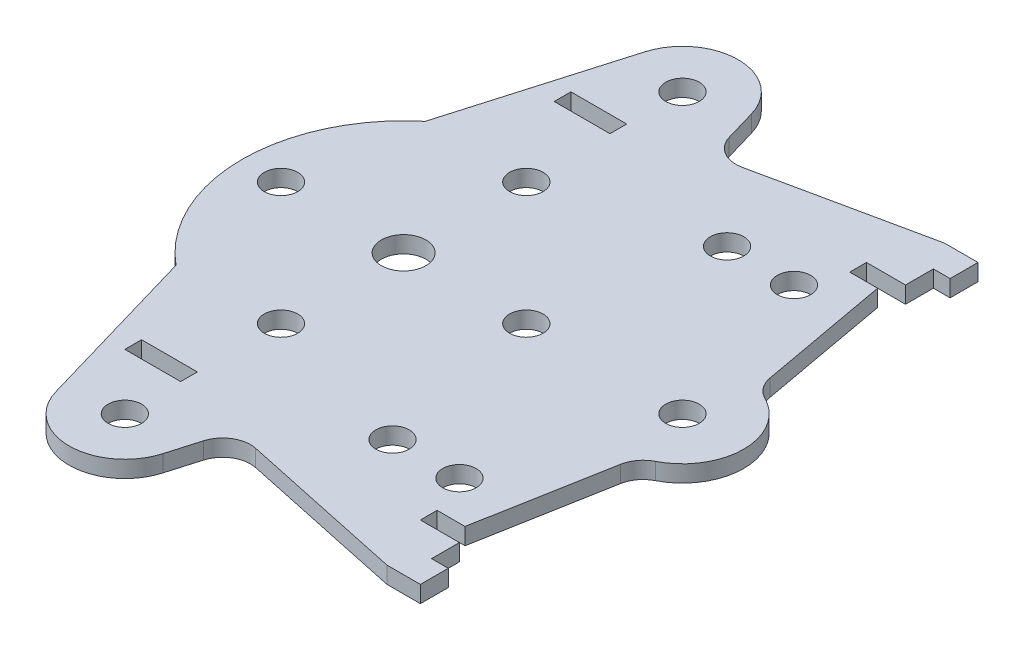
from build123d import *

# Parameters (mm, degrees)
SZKIC1_R                    = 3
SZKIC1_R_2                  = 4
SZKIC1_W                    = 10
SZKIC1_H                    = 3
DODANIE_WYCI_GNI_CIE1_DEPTH = 3


with BuildPart() as part:
    # Szkic1 → Dodanie-wyciągnięcie1 (new body)
    with BuildSketch(Plane(origin=(0, 0, 0), x_dir=(1, 0, 0), z_dir=(0, 1, 0))):
        with BuildLine():
            Line((11.254405736, 47.127751764), (9.6, 52.8))
            ThreePointArc((9.6, 52.8), (0, 60), (-9.6, 52.8))
            Line((-9.6, 52.8), (-18.481930233, 22.347667772))
            ThreePointArc((-18.481930233, 22.347667772), (-29, 0), (-18.481930233, -22.347667772))
            Line((-18.481930233, -22.347667772), (-9.6, -52.8))
            ThreePointArc((-9.6, -52.8), (0, -60), (9.6, -52.8))
            Line((9.6, -52.8), (11.254405736, -47.127751764))
            ThreePointArc((11.254405736, -47.127751764), (13.489383803, -44.235821838), (17.094943958, -43.637222119))
            Line((17.094943958, -43.637222119), (47, -50))
            Line((47, -50), (53, -50))
            Line((53, -50), (53, -45))
            Line((53, -45), (50, -45))
            Line((50, -45), (50, -40))
            Line((50, -40), (43, -40))
            Line((43, -40), (43, -37))
            Line((43, -37), (48, -37))
            Line((48, -37), (52.30014877, -13.383060071))
            ThreePointArc((52.30014877, -13.383060071), (53.212959439, -11.287164894), (54.963249746, -9.816626302))
            ThreePointArc((54.963249746, -9.816626302), (61, 0), (54.963249746, 9.816626302))
            ThreePointArc((54.963249746, 9.816626302), (53.212959439, 11.287164894), (52.30014877, 13.383060071))
            Line((52.30014877, 13.383060071), (48, 37))
            Line((48, 37), (43, 37))
            Line((43, 37), (43, 40))
            Line((43, 40), (50, 40))
            Line((50, 40), (50, 45))
            Line((50, 45), (53, 45))
            Line((53, 45), (53, 50))
            Line((53, 50), (47, 50))
            Line((47, 50), (17.094943958, 43.637222119))
            ThreePointArc((17.094943958, 43.637222119), (13.489383803, 44.235821838), (11.254405736, 47.127751764))
        make_face()
        with Locations((0, 50)):
            Circle(SZKIC1_R, mode=Mode.SUBTRACT)
        with Locations((0, -50)):
            Circle(SZKIC1_R, mode=Mode.SUBTRACT)
        with Locations((0, 22)):
            Circle(SZKIC1_R, mode=Mode.SUBTRACT)
        with Locations((0, -22)):
            Circle(SZKIC1_R, mode=Mode.SUBTRACT)
        with Locations((-22, 0)):
            Circle(SZKIC1_R, mode=Mode.SUBTRACT)
        with Locations((50, 0)):
            Circle(SZKIC1_R, mode=Mode.SUBTRACT)
        with Locations((22, 0)):
            Circle(SZKIC1_R, mode=Mode.SUBTRACT)
        Circle(SZKIC1_R_2, mode=Mode.SUBTRACT)
        with Locations((40, -30)):
            Circle(SZKIC1_R, mode=Mode.SUBTRACT)
        with Locations((40, 30)):
            Circle(SZKIC1_R, mode=Mode.SUBTRACT)
        with Locations((28, -30)):
            Circle(SZKIC1_R, mode=Mode.SUBTRACT)
        with Locations((28, 30)):
            Circle(SZKIC1_R, mode=Mode.SUBTRACT)
        with Locations((-5, 38.5)):
            Rectangle(SZKIC1_W, SZKIC1_H, mode=Mode.SUBTRACT)
        with Locations((-5, -38.5)):
            Rectangle(SZKIC1_W, SZKIC1_H, mode=Mode.SUBTRACT)
    extrude(amount=DODANIE_WYCI_GNI_CIE1_DEPTH)


solid = part.part
